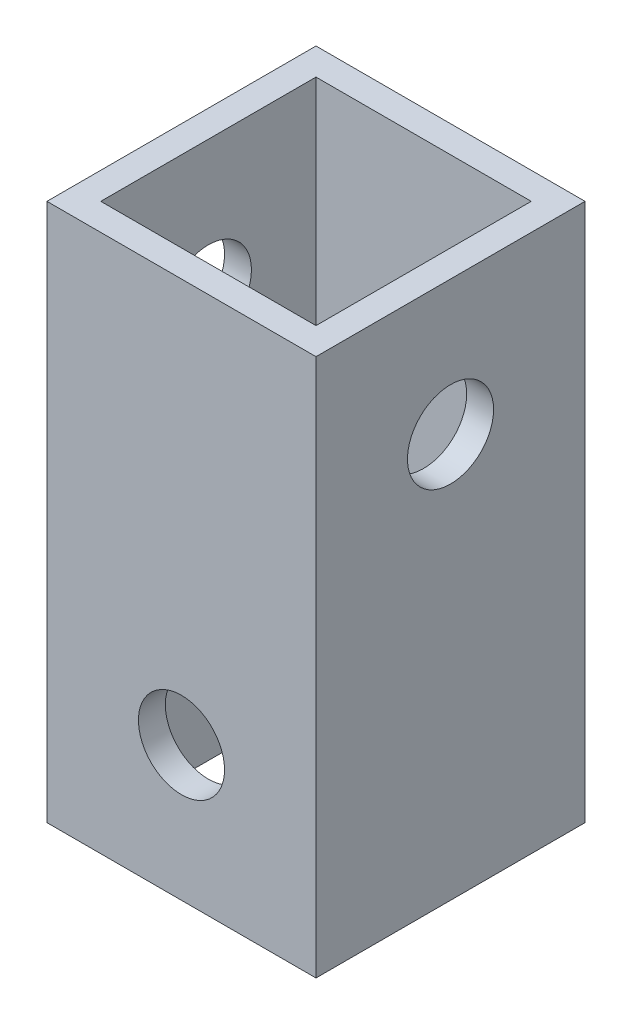
from build123d import *

# Parameters (mm, degrees)
SKETCH_1_W          = 10
SKETCH_1_H          = 10
SKETCH_1_W_2        = 8
SKETCH_1_H_2        = 8
EXTRUDE_1_DEPTH     = 20
SKETCH_2_R          = 1.6
CUT_EXTRUDE_1_DEPTH = 23.912878475
SKETCH_3_R          = 1.6
CUT_EXTRUDE_2_DEPTH = 23.912878475


with BuildPart() as part:
    # ｽｹｯﾁ1 → 押し出し-薄板1 (new body)
    with BuildSketch(Plane(origin=(0, 0, 0), x_dir=(1, 0, 0), z_dir=(0, 1, 0))):
        Rectangle(SKETCH_1_W, SKETCH_1_H)
        Rectangle(SKETCH_1_W_2, SKETCH_1_H_2, mode=Mode.SUBTRACT)
    extrude(amount=EXTRUDE_1_DEPTH)

    # ｽｹｯﾁ2 → ｶｯﾄ - 押し出し1 (cut, through all)
    with BuildSketch(Plane.XY.offset(5)):
        with Locations((0, 5)):
            Circle(SKETCH_2_R)
    extrude(amount=-CUT_EXTRUDE_1_DEPTH, mode=Mode.SUBTRACT)

    # ｽｹｯﾁ3 → ｶｯﾄ - 押し出し2 (cut, through all)
    with BuildSketch(Plane(origin=(5, 0, 0), x_dir=(0, 0, -1), z_dir=(1, 0, 0))):
        with Locations((0, 15)):
            Circle(SKETCH_3_R)
    extrude(amount=-CUT_EXTRUDE_2_DEPTH, mode=Mode.SUBTRACT)


solid = part.part
